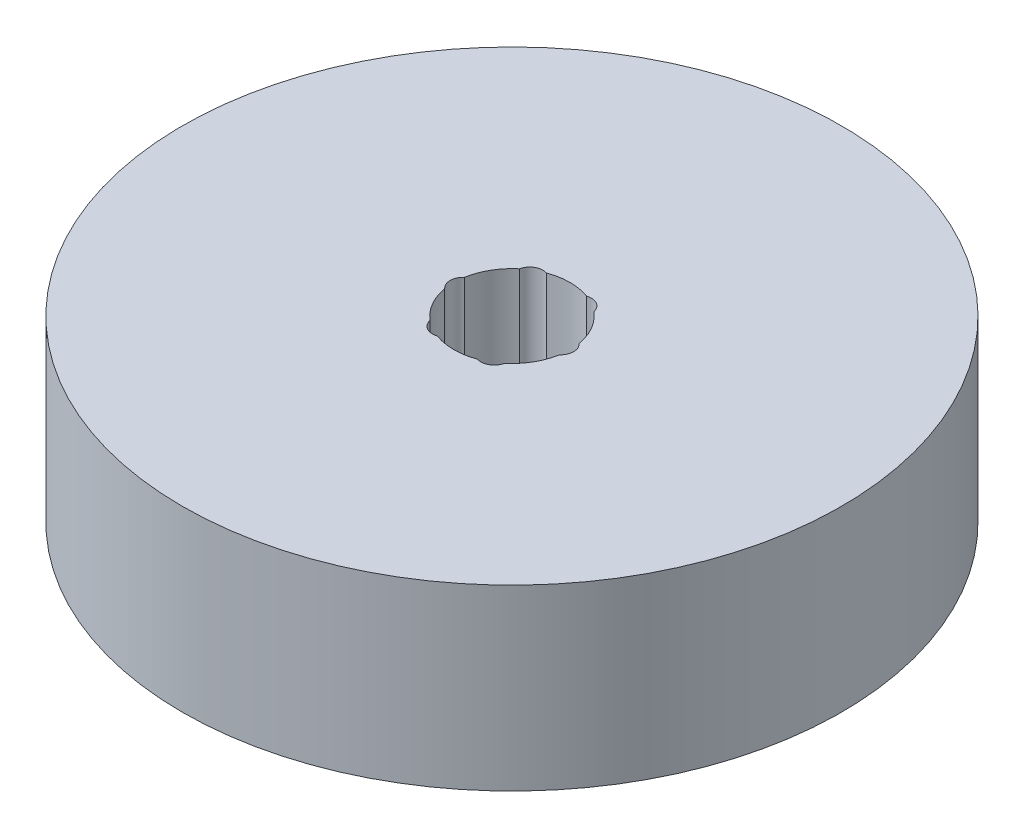
from build123d import *

# Parameters (mm, degrees)
SKETCH1_R           = 42.5
BOSS_EXTRUDE1_DEPTH = 23
SKETCH2_R           = 7.5
CUT_EXTRUDE1_DEPTH  = 65.354487023
SKETCH3_R           = 1.721944662
CUT_EXTRUDE2_DEPTH  = 21.06869199
CIRPATTERN1_COUNT   = 6


with BuildPart() as part:
    # Sketch1 → Boss-Extrude1 (new body)
    with BuildSketch(Plane(origin=(0, 0, 0), x_dir=(1, 0, 0), z_dir=(0, 1, 0))):
        Circle(SKETCH1_R)
    extrude(amount=BOSS_EXTRUDE1_DEPTH)

    # Sketch2 → Cut-Extrude1 (cut, through all)
    with BuildSketch(Plane(origin=(0, 0, 0), x_dir=(1, 0, 0), z_dir=(0, 1, 0))):
        Circle(SKETCH2_R)
    extrude(amount=CUT_EXTRUDE1_DEPTH, mode=Mode.SUBTRACT)

    # Sketch3 → Cut-Extrude2 (cut)
    with BuildSketch(Plane(origin=(0, 23, 0), x_dir=(1, 0, 0), z_dir=(0, 1, 0))):
        with Locations((-6.236582965, 0)):
            Circle(SKETCH3_R)
    cut_extrude2 = extrude(amount=-CUT_EXTRUDE2_DEPTH, mode=Mode.SUBTRACT)

    # CirPattern1: Cut-Extrude2 ×6 about axis
    cirpattern1_axis = Axis((0, 0, 0), (0, 1, 0))
    for i in range(1, CIRPATTERN1_COUNT):
        add(cut_extrude2.rotate(cirpattern1_axis, i * 360 / CIRPATTERN1_COUNT), mode=Mode.SUBTRACT)


solid = part.part
